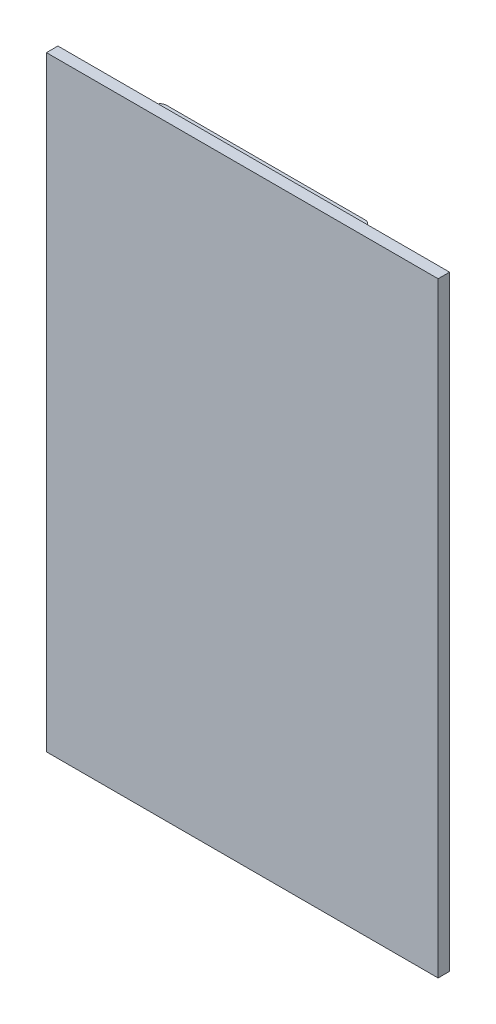
from build123d import *

# Parameters (mm, degrees)
SKETCH1_W           = 65
SKETCH1_H           = 100.5
BOSS_EXTRUDE1_DEPTH = 1.9
SKETCH2_W           = 35
SKETCH2_H           = 3
BOSS_EXTRUDE2_DEPTH = 2
FILLET2_R           = 1


with BuildPart() as part:
    # Sketch1 → Boss-Extrude1 (new body)
    with BuildSketch(Plane.XY):
        with Locations((34, 51.75)):
            Rectangle(SKETCH1_W, SKETCH1_H)
    extrude(amount=BOSS_EXTRUDE1_DEPTH)

    # Sketch2 → Boss-Extrude2 (add)
    with BuildSketch(Plane(origin=(0, 0, 0), x_dir=(-1, 0, 0), z_dir=(0, 0, -1))):
        with Locations((-34, 99)):
            Rectangle(SKETCH2_W, SKETCH2_H)
    extrude(amount=BOSS_EXTRUDE2_DEPTH)

    # Fillet2
    fillet2_edges = [part.edges().sort_by_distance(p)[0] for p in [
        (51.5, 99, 0),
        (34, 97.5, 0),
        (51.5, 97.5, -1),
        (16.5, 99, 0),
        (16.5, 97.5, -1),
        (51.5, 99, -2),
        (34, 97.5, -2),
        (16.5, 99, -2),
    ]]
    fillet(fillet2_edges, radius=FILLET2_R - 0.0001)  # a hair under: the kernel refuses the full size


solid = part.part
